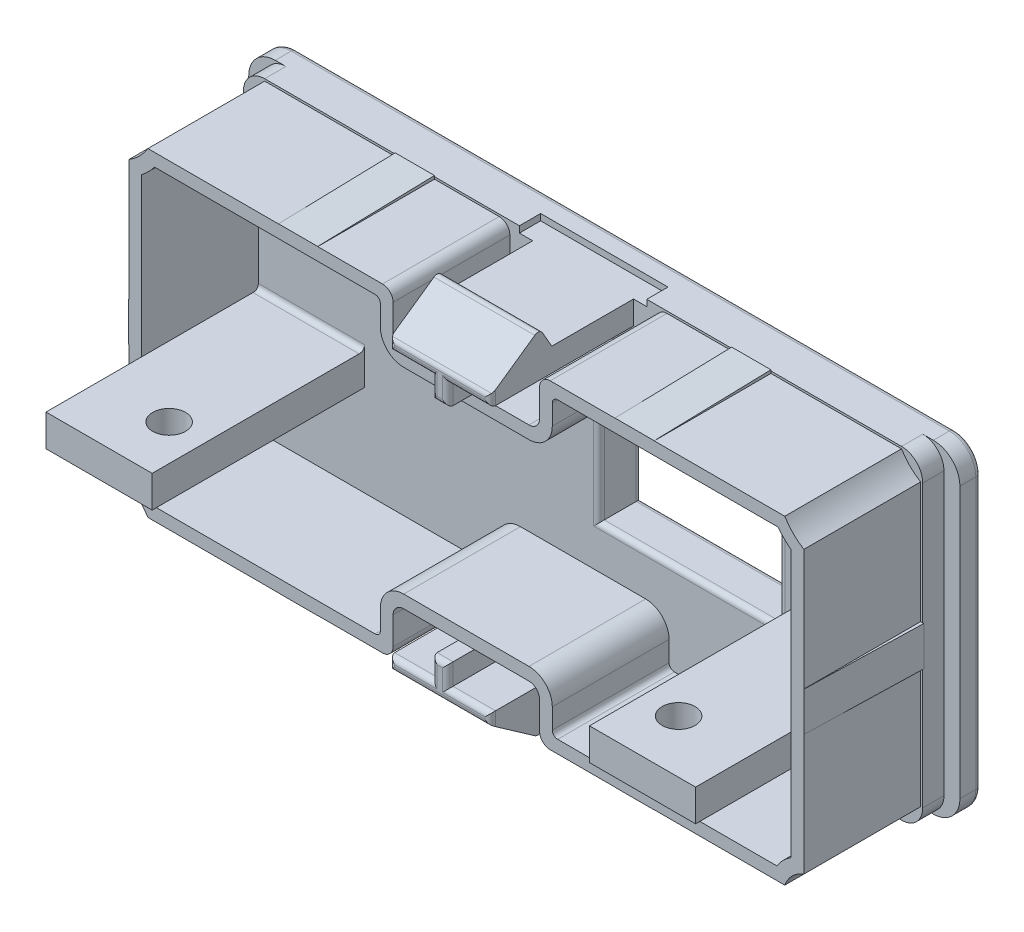
from build123d import *

# Parameters (mm, degrees)
BOSS_EXTRUDE1_DEPTH  = 2
FILLET2_R            = 0.5
BOSS_EXTRUDE2_DEPTH  = 2
SKETCH4_W            = 17
SKETCH4_H            = 14
CUT_EXTRUDE1_DEPTH   = 38.024485273
FILLET3_R            = 0.5
BOSS_EXTRUDE3_DEPTH  = 11
FILLET5_R            = 0.5
SKETCH6_W            = 12
SKETCH6_H            = 0.6
CUT_EXTRUDE2_DEPTH   = 2
BOSS_EXTRUDE4_DEPTH  = 13.5
SKETCH21_W           = 9.5
SKETCH21_H           = 4.65
BOSS_EXTRUDE14_DEPTH = 2
SKETCH22_W           = 9.5
SKETCH22_H           = 4.65
BOSS_EXTRUDE15_DEPTH = 2
DRAFT13_ANGLE        = 30
DRAFT15_ANGLE        = 30
DRAFT16_START        = 21.009338745
DRAFT16_OUTLINE_W    = 9.5
DRAFT16_OUTLINE_H    = 9
DRAFT16_DEPTH        = 3.990661255
DRAFT18_START        = -25
DRAFT18_OUTLINE_W    = 9.5
DRAFT18_OUTLINE_H    = 9
DRAFT18_DEPTH        = 3.990661255
SKETCH12_W           = 3.7
SKETCH12_H           = 11
BOSS_EXTRUDE7_DEPTH  = 0.3
SKETCH14_W           = 3.7
SKETCH14_H           = 11
BOSS_EXTRUDE10_DEPTH = 0.3
SKETCH15_W           = 11
SKETCH15_H           = 3.7
BOSS_EXTRUDE11_DEPTH = 0.3
SKETCH16_W           = 11
SKETCH16_H           = 3.7
BOSS_EXTRUDE12_DEPTH = 0.3
SKETCH17_W           = 10
SKETCH17_H           = 3
BOSS_EXTRUDE13_DEPTH = 20
SKETCH19_R           = 1.55
CUT_EXTRUDE4_DEPTH   = 46.337181283
DRAFT12_ANGLE        = 1.5
FILLET36_SIZE        = 0.5
FILLET37_SIZE        = 0.5
FILLET38_R           = 0.5
FILLET39_R           = 0.5


with BuildPart() as part:
    # Sketch1 → Boss-Extrude1 (new body)
    with BuildSketch(Plane.XY):
        with BuildLine():
            Line((-31, 15.25), (31, 15.25))
            ThreePointArc((31, 15.25), (32.767766953, 14.517766953), (33.5, 12.75))
            Line((33.5, 12.75), (33.5, -12.75))
            ThreePointArc((33.5, -12.75), (32.767766953, -14.517766953), (31, -15.25))
            Line((31, -15.25), (-31, -15.25))
            ThreePointArc((-31, -15.25), (-32.767766953, -14.517766953), (-33.5, -12.75))
            Line((-33.5, -12.75), (-33.5, 12.75))
            ThreePointArc((-33.5, 12.75), (-32.767766953, 14.517766953), (-31, 15.25))
        make_face()
    extrude(amount=BOSS_EXTRUDE1_DEPTH)

    # Fillet2
    fillet2_edges = [part.edges().sort_by_distance(p)[0] for p in [
        (0, -15.25, 0),
        (-32.767766953, -14.517766953, 0),
        (-33.5, 0, 0),
        (-32.767766953, 14.517766953, 0),
        (0, 15.25, 0),
        (32.767766953, 14.517766953, 0),
        (33.5, 0, 0),
        (32.767766953, -14.517766953, 0),
    ]]
    fillet(fillet2_edges, radius=FILLET2_R)

    # Sketch2 → Boss-Extrude2 (add)
    with BuildSketch(Plane.XY.offset(2)):
        with BuildLine():
            Line((-30, 15.25), (30, 15.25))
            ThreePointArc((30, 15.25), (31.414213562, 14.664213562), (32, 13.25))
            Line((32, 13.25), (32, -13.25))
            ThreePointArc((32, -13.25), (31.414213562, -14.664213562), (30, -15.25))
            Line((30, -15.25), (-30, -15.25))
            ThreePointArc((-30, -15.25), (-31.414213562, -14.664213562), (-32, -13.25))
            Line((-32, -13.25), (-32, 13.25))
            ThreePointArc((-32, 13.25), (-31.414213562, 14.664213562), (-30, 15.25))
        make_face()
    extrude(amount=BOSS_EXTRUDE2_DEPTH)

    # Sketch4 → Cut-Extrude1 (cut, through all)
    with BuildSketch(Plane(origin=(0, 0, 0), x_dir=(-1, 0, 0), z_dir=(0, 0, -1))):
        with Locations((-10, 1.75)):
            Rectangle(SKETCH4_W, SKETCH4_H)
    extrude(amount=-CUT_EXTRUDE1_DEPTH, mode=Mode.SUBTRACT)

    # Fillet3
    fillet3_edges = [part.edges().sort_by_distance(p)[0] for p in [
        (1.5, 1.75, 0),
        (10, 8.75, 0),
        (18.5, 1.75, 0),
        (10, -5.25, 0),
    ]]
    fillet(fillet3_edges, radius=FILLET3_R)

    # Sketch5 → Boss-Extrude3 (add)
    with BuildSketch(Plane.XY.offset(4)):
        with BuildLine():
            Line((-6.9, 14.05), (-6.9, 11.45))
            ThreePointArc((-6.9, 11.45), (-6.607106781, 10.742893219), (-5.9, 10.45))
            Line((-5.9, 10.45), (5.9, 10.45))
            ThreePointArc((5.9, 10.45), (6.607106781, 10.742893219), (6.9, 11.45))
            Line((6.9, 11.45), (6.9, 14.05))
            ThreePointArc((6.9, 14.05), (7.192893219, 14.757106781), (7.9, 15.05))
            Line((7.9, 15.05), (30, 15.05))
            ThreePointArc((30, 15.05), (30.792418445, 14.042418445), (31.8, 13.25))
            Line((31.8, 13.25), (31.8, -13.25))
            ThreePointArc((31.8, -13.25), (30.699616928, -13.949616928), (30, -15.05))
            Line((30, -15.05), (7.9, -15.05))
            ThreePointArc((7.9, -15.05), (7.192893219, -14.757106781), (6.9, -14.05))
            Line((6.9, -14.05), (6.9, -11.45))
            ThreePointArc((6.9, -11.45), (6.607106781, -10.742893219), (5.9, -10.45))
            Line((5.9, -10.45), (-5.9, -10.45))
            ThreePointArc((-5.9, -10.45), (-6.607106781, -10.742893219), (-6.9, -11.45))
            Line((-6.9, -11.45), (-6.9, -14.05))
            ThreePointArc((-6.9, -14.05), (-7.192893219, -14.757106781), (-7.9, -15.05))
            Line((-7.9, -15.05), (-30, -15.05))
            ThreePointArc((-30, -15.05), (-30.792418445, -14.042418445), (-31.8, -13.25))
            Line((-31.8, -13.25), (-31.8, 13.25))
            ThreePointArc((-31.8, 13.25), (-30.792418445, 14.042418445), (-30, 15.05))
            Line((-30, 15.05), (-7.9, 15.05))
            ThreePointArc((-7.9, 15.05), (-7.192893219, 14.757106781), (-6.9, 14.05))
        make_face()
        with BuildLine():
            Line((29.256187962, -13.85), (8.1, -13.85))
            Line((8.1, -13.85), (8.1, -11.45))
            ThreePointArc((8.1, -11.45), (7.455634919, -9.894365081), (5.9, -9.25))
            Line((5.9, -9.25), (-5.9, -9.25))
            ThreePointArc((-5.9, -9.25), (-7.455634919, -9.894365081), (-8.1, -11.45))
            Line((-8.1, -11.45), (-8.1, -13.85))
            Line((-8.1, -13.85), (-29.369275917, -13.85))
            ThreePointArc((-29.369275917, -13.85), (-29.943890307, -13.193890307), (-30.6, -12.619275917))
            Line((-30.6, -12.619275917), (-30.6, 12.619275917))
            ThreePointArc((-30.6, 12.619275917), (-29.943890307, 13.193890307), (-29.369275917, 13.85))
            Line((-29.369275917, 13.85), (-8.1, 13.85))
            Line((-8.1, 13.85), (-8.1, 11.45))
            ThreePointArc((-8.1, 11.45), (-7.455634919, 9.894365081), (-5.9, 9.25))
            Line((-5.9, 9.25), (5.9, 9.25))
            ThreePointArc((5.9, 9.25), (7.455634919, 9.894365081), (8.1, 11.45))
            Line((8.1, 11.45), (8.1, 13.85))
            Line((8.1, 13.85), (29.369275917, 13.85))
            ThreePointArc((29.369275917, 13.85), (29.943890307, 13.193890307), (30.6, 12.619275917))
            Line((30.6, 12.619275917), (30.6, -12.506187962))
            ThreePointArc((30.6, -12.506187962), (29.85108879, -13.10108879), (29.256187962, -13.85))
        make_face(mode=Mode.SUBTRACT)
    extrude(amount=BOSS_EXTRUDE3_DEPTH)

    # Fillet5
    fillet5_edges = [part.edges().sort_by_distance(p)[0] for p in [
        (8.1, 13.85, 9.5),
        (-8.1, 13.85, 9.5),
        (-8.1, -13.85, 9.5),
        (8.1, -13.85, 9.5),
    ]]
    fillet(fillet5_edges, radius=FILLET5_R)

    # Sketch6 → Cut-Extrude2 (cut)
    with BuildSketch(Plane.XY.offset(4)):
        with Locations((0, 14.95)):
            Rectangle(SKETCH6_W, SKETCH6_H)
        with Locations((0, -14.95)):
            Rectangle(SKETCH6_W, SKETCH6_H)
    extrude(amount=-CUT_EXTRUDE2_DEPTH, mode=Mode.SUBTRACT)

    # Sketch7 → Boss-Extrude4 (add)
    with BuildSketch(Plane.XY.offset(4)):
        Polygon((-4.75, 14.65), (4.75, 14.65), (4.75, 12.45), (0.75, 12.45), (0.75, 10.45), (-0.75, 10.45), (-0.75, 12.45), (-4.75, 12.45), align=None)
        Polygon((-4.75, -12.45), (-4.75, -14.65), (4.75, -14.65), (4.75, -12.45), (0.75, -12.45), (0.75, -10.45), (-0.75, -10.45), (-0.75, -12.45), align=None)
    extrude(amount=BOSS_EXTRUDE4_DEPTH)

    # Sketch21 → Boss-Extrude14 (add)
    with BuildSketch(Plane(origin=(0, 14.65, 0), x_dir=(1, 0, 0), z_dir=(0, 1, 0))):
        with Locations((0, -15.175)):
            Rectangle(SKETCH21_W, SKETCH21_H)
    extrude(amount=BOSS_EXTRUDE14_DEPTH)

    # Sketch22 → Boss-Extrude15 (add)
    with BuildSketch(Plane.XZ.offset(14.65)):
        with Locations((0, 15.175)):
            Rectangle(SKETCH22_W, SKETCH22_H)
    extrude(amount=BOSS_EXTRUDE15_DEPTH)

    # Draft13
    draft13_faces = [part.faces().sort_by_distance(p)[0] for p in [
        (0, -15.65, 12.85),
    ]]
    draft(draft13_faces, Plane(origin=(0, -16.65, 0), x_dir=(-1, 0, 0), z_dir=(0, -1, 0)), DRAFT13_ANGLE)

    # Draft15
    draft15_faces = [part.faces().sort_by_distance(p)[0] for p in [
        (0, 15.65, 12.85),
    ]]
    draft(draft15_faces, Plane.ZX.offset(16.65), DRAFT15_ANGLE)

    # Draft16: read off the stored shape, not the designer's step
    # Draft16 outline → Draft16 (cut)
    with BuildSketch(Plane(origin=(0, 0, 0), x_dir=(1, 0, 0), z_dir=(0, 0.8191520442889911, 0.5735764363510472)).offset(DRAFT16_START)):
        with Locations((0, -3.5)):
            Rectangle(DRAFT16_OUTLINE_W, DRAFT16_OUTLINE_H)
    extrude(amount=DRAFT16_DEPTH, mode=Mode.SUBTRACT)

    # Draft18: read off the stored shape, not the designer's step
    # Draft18 outline → Draft18 (cut)
    with BuildSketch(Plane(origin=(0, 0, 0), x_dir=(1, 0, 0), z_dir=(0, 0.8191520442889911, -0.5735764363510472)).offset(DRAFT18_START)):
        with Locations((0, -3.5)):
            Rectangle(DRAFT18_OUTLINE_W, DRAFT18_OUTLINE_H)
    extrude(amount=DRAFT18_DEPTH, mode=Mode.SUBTRACT)

    # Sketch12 → Boss-Extrude7 (add)
    with BuildSketch(Plane(origin=(0, 15.05, 0), x_dir=(1, 0, 0), z_dir=(0, 1, 0))):
        with Locations((15.85, -9.5)):
            Rectangle(SKETCH12_W, SKETCH12_H)
        with Locations((-15.85, -9.5)):
            Rectangle(SKETCH12_W, SKETCH12_H)
    extrude(amount=BOSS_EXTRUDE7_DEPTH)

    # Sketch14 → Boss-Extrude10 (add)
    with BuildSketch(Plane.XZ.offset(15.05)):
        with Locations((15.85, 9.5)):
            Rectangle(SKETCH14_W, SKETCH14_H)
        with Locations((-15.85, 9.5)):
            Rectangle(SKETCH14_W, SKETCH14_H)
    extrude(amount=BOSS_EXTRUDE10_DEPTH)

    # Sketch15 → Boss-Extrude11 (add)
    with BuildSketch(Plane.ZY.offset(31.8)):
        with Locations((9.5, 0)):
            Rectangle(SKETCH15_W, SKETCH15_H)
    extrude(amount=BOSS_EXTRUDE11_DEPTH)

    # Sketch16 → Boss-Extrude12 (add)
    with BuildSketch(Plane(origin=(31.8, 0, 0), x_dir=(0, 0, -1), z_dir=(1, 0, 0))):
        with Locations((-9.5, 0)):
            Rectangle(SKETCH16_W, SKETCH16_H)
    extrude(amount=BOSS_EXTRUDE12_DEPTH)

    # Sketch17 → Boss-Extrude13 (add)
    with BuildSketch(Plane.XY.offset(4)):
        with Locations((-25.6, -3.75)):
            Rectangle(SKETCH17_W, SKETCH17_H)
        with Locations((25.6, -3.75)):
            Rectangle(SKETCH17_W, SKETCH17_H)
    extrude(amount=BOSS_EXTRUDE13_DEPTH)

    # Sketch19 → Cut-Extrude4 (cut, through all)
    with BuildSketch(Plane(origin=(0, -2.25, 0), x_dir=(1, 0, 0), z_dir=(0, 1, 0))):
        with Locations(Location((-24, -19, 0), (0, 0, 180))):
            Circle(SKETCH19_R)
        with Locations(Location((24, -19, 0), (0, 0, 180))):
            Circle(SKETCH19_R)
    extrude(amount=-CUT_EXTRUDE4_DEPTH, mode=Mode.SUBTRACT)

    # Draft12
    draft12_faces = [part.faces().sort_by_distance(p)[0] for p in [
        (-15.85, -15.35, 9.5),
        (15.85, -15.35, 9.5),
        (32.1, 0, 9.5),
        (-32.1, 0, 9.5),
        (15.85, 15.35, 9.5),
        (-15.85, 15.35, 9.5),
    ]]
    draft(draft12_faces, Plane(origin=(-30, -13.25, 4), x_dir=(1, 0, 0), z_dir=(0, 0, 1)), DRAFT12_ANGLE)

    # Fillet36
    # a fillet whose section is not a circle: 0.5 mm, written as the material it takes off along each edge
    with BuildSketch(Plane(origin=(1.5, -5.25, 4), x_dir=(0, -1, 0), z_dir=(1, 0, 0)), Plane(origin=(18.5, 8.75, 4), x_dir=(0, 1, 0), z_dir=(-1, 0, 0))) as fillet36_piece_1:
        with BuildLine():
            Bezier((FILLET36_SIZE, 0), (0, 0), (0, FILLET36_SIZE), weights=[1, 1, 1])
            Line((0, FILLET36_SIZE), (0, 0))
            Line((0, 0), (FILLET36_SIZE, 0))
        make_face()
    extrude(amount=17, mode=Mode.SUBTRACT)
    with BuildSketch(Plane(origin=(18.5, -5.25, 4), x_dir=(1, 0, 0), z_dir=(0, 1, 0)), Plane(origin=(1.5, 8.75, 4), x_dir=(-1, 0, 0), z_dir=(0, -1, 0))) as fillet36_piece_2:
        with BuildLine():
            Bezier((FILLET36_SIZE, 0), (0, 0), (0, FILLET36_SIZE), weights=[1, 1, 1])
            Line((0, FILLET36_SIZE), (0, 0))
            Line((0, 0), (FILLET36_SIZE, 0))
        make_face()
    extrude(amount=14, mode=Mode.SUBTRACT)
    with BuildSketch(Plane(origin=(0.25, -5.25, 4), x_dir=(0, -1, 0), z_dir=(1, 0, 0))) as fillet36_piece_3a_section:
        with BuildLine():
            Bezier((FILLET36_SIZE, 0), (0, 0), (0, FILLET36_SIZE), weights=[1, 1, 1])
            Line((0, FILLET36_SIZE), (0, 0))
            Line((0, 0), (FILLET36_SIZE, 0))
        make_face()
    fillet36_piece_3a = extrude(amount=18.25, mode=Mode.PRIVATE)
    fillet36_piece_3a = split(fillet36_piece_3a, bisect_by=Plane(origin=(1.5, -5.25, 4), z_dir=(-1, 0, 0)), keep=Keep.TOP, mode=Mode.PRIVATE)
    with BuildSketch(Plane(origin=(1.5, 8.75, 4), x_dir=(-1, 0, 0), z_dir=(0, -1, 0))) as fillet36_piece_3b_section:
        with BuildLine():
            Bezier((FILLET36_SIZE, 0), (0, 0), (0, FILLET36_SIZE), weights=[1, 1, 1])
            Line((0, FILLET36_SIZE), (0, 0))
            Line((0, 0), (FILLET36_SIZE, 0))
        make_face()
    fillet36_piece_3b = extrude(amount=15.25, mode=Mode.PRIVATE)
    fillet36_piece_3b = split(fillet36_piece_3b, bisect_by=Plane(origin=(1.5, -5.25, 4), z_dir=(0, -1, 0)), keep=Keep.TOP, mode=Mode.PRIVATE)
    fillet36_piece_3 = fillet36_piece_3a & fillet36_piece_3b
    add(fillet36_piece_3, mode=Mode.SUBTRACT)
    with BuildSketch(Plane(origin=(18.5, -6.5, 4), x_dir=(1, 0, 0), z_dir=(0, 1, 0))) as fillet36_piece_4a_section:
        with BuildLine():
            Bezier((FILLET36_SIZE, 0), (0, 0), (0, FILLET36_SIZE), weights=[1, 1, 1])
            Line((0, FILLET36_SIZE), (0, 0))
            Line((0, 0), (FILLET36_SIZE, 0))
        make_face()
    fillet36_piece_4a = extrude(amount=15.25, mode=Mode.PRIVATE)
    fillet36_piece_4a = split(fillet36_piece_4a, bisect_by=Plane(origin=(18.5, -5.25, 4), z_dir=(0, -1, 0)), keep=Keep.TOP, mode=Mode.PRIVATE)
    with BuildSketch(Plane(origin=(1.5, -5.25, 4), x_dir=(0, -1, 0), z_dir=(1, 0, 0))) as fillet36_piece_4b_section:
        with BuildLine():
            Bezier((FILLET36_SIZE, 0), (0, 0), (0, FILLET36_SIZE), weights=[1, 1, 1])
            Line((0, FILLET36_SIZE), (0, 0))
            Line((0, 0), (FILLET36_SIZE, 0))
        make_face()
    fillet36_piece_4b = extrude(amount=18.25, mode=Mode.PRIVATE)
    fillet36_piece_4b = split(fillet36_piece_4b, bisect_by=Plane(origin=(18.5, -5.25, 4), z_dir=(1, 0, 0)), keep=Keep.TOP, mode=Mode.PRIVATE)
    fillet36_piece_4 = fillet36_piece_4a & fillet36_piece_4b
    add(fillet36_piece_4, mode=Mode.SUBTRACT)
    with BuildSketch(Plane(origin=(18.5, -5.25, 4), x_dir=(1, 0, 0), z_dir=(0, 1, 0))) as fillet36_piece_5a_section:
        with BuildLine():
            Bezier((FILLET36_SIZE, 0), (0, 0), (0, FILLET36_SIZE), weights=[1, 1, 1])
            Line((0, FILLET36_SIZE), (0, 0))
            Line((0, 0), (FILLET36_SIZE, 0))
        make_face()
    fillet36_piece_5a = extrude(amount=15.25, mode=Mode.PRIVATE)
    fillet36_piece_5a = split(fillet36_piece_5a, bisect_by=Plane(origin=(18.5, 8.75, 4), z_dir=(0, 1, 0)), keep=Keep.TOP, mode=Mode.PRIVATE)
    with BuildSketch(Plane(origin=(19.75, 8.75, 4), x_dir=(0, 1, 0), z_dir=(-1, 0, 0))) as fillet36_piece_5b_section:
        with BuildLine():
            Bezier((FILLET36_SIZE, 0), (0, 0), (0, FILLET36_SIZE), weights=[1, 1, 1])
            Line((0, FILLET36_SIZE), (0, 0))
            Line((0, 0), (FILLET36_SIZE, 0))
        make_face()
    fillet36_piece_5b = extrude(amount=18.25, mode=Mode.PRIVATE)
    fillet36_piece_5b = split(fillet36_piece_5b, bisect_by=Plane(origin=(18.5, 8.75, 4), z_dir=(1, 0, 0)), keep=Keep.TOP, mode=Mode.PRIVATE)
    fillet36_piece_5 = fillet36_piece_5a & fillet36_piece_5b
    add(fillet36_piece_5, mode=Mode.SUBTRACT)
    with BuildSketch(Plane(origin=(18.5, 8.75, 4), x_dir=(0, 1, 0), z_dir=(-1, 0, 0))) as fillet36_piece_6a_section:
        with BuildLine():
            Bezier((FILLET36_SIZE, 0), (0, 0), (0, FILLET36_SIZE), weights=[1, 1, 1])
            Line((0, FILLET36_SIZE), (0, 0))
            Line((0, 0), (FILLET36_SIZE, 0))
        make_face()
    fillet36_piece_6a = extrude(amount=18.25, mode=Mode.PRIVATE)
    fillet36_piece_6a = split(fillet36_piece_6a, bisect_by=Plane(origin=(1.5, 8.75, 4), z_dir=(-1, 0, 0)), keep=Keep.TOP, mode=Mode.PRIVATE)
    with BuildSketch(Plane(origin=(1.5, 10, 4), x_dir=(-1, 0, 0), z_dir=(0, -1, 0))) as fillet36_piece_6b_section:
        with BuildLine():
            Bezier((FILLET36_SIZE, 0), (0, 0), (0, FILLET36_SIZE), weights=[1, 1, 1])
            Line((0, FILLET36_SIZE), (0, 0))
            Line((0, 0), (FILLET36_SIZE, 0))
        make_face()
    fillet36_piece_6b = extrude(amount=15.25, mode=Mode.PRIVATE)
    fillet36_piece_6b = split(fillet36_piece_6b, bisect_by=Plane(origin=(1.5, 9.25, 4), z_dir=(0, -1, 0)), keep=Keep.TOP, mode=Mode.PRIVATE)
    fillet36_piece_6b = split(fillet36_piece_6b, bisect_by=Plane(origin=(1.5, 8.75, 4), z_dir=(0, 1, 0)), keep=Keep.TOP, mode=Mode.PRIVATE)
    fillet36_piece_6 = fillet36_piece_6a & fillet36_piece_6b
    add(fillet36_piece_6, mode=Mode.SUBTRACT)

    # Fillet37
    # a fillet whose section is not a circle: 0.5 mm, written as the material it adds along each edge
    with BuildSketch(Plane(origin=(20.6, -2.25, 4), x_dir=(0, 1, 0), z_dir=(1, 0, 0))) as fillet37_piece_1_section:
        with BuildLine():
            Bezier((FILLET37_SIZE, 0), (0, 0), (0, FILLET37_SIZE), weights=[1, 1, 1])
            Line((0, FILLET37_SIZE), (0, 0))
            Line((0, 0), (FILLET37_SIZE, 0))
        make_face()
    fillet37_piece_1 = extrude(amount=11.25, mode=Mode.PRIVATE)
    fillet37_piece_1 = split(fillet37_piece_1, bisect_by=Plane(origin=(31.8, -2.25, 4), z_dir=(-1, 0, 0)), keep=Keep.TOP, mode=Mode.PRIVATE)
    add(fillet37_piece_1)
    with BuildSketch(Plane(origin=(-31.85, -2.25, 4), x_dir=(0, 1, 0), z_dir=(1, 0, 0))) as fillet37_piece_2_section:
        with BuildLine():
            Bezier((FILLET37_SIZE, 0), (0, 0), (0, FILLET37_SIZE), weights=[1, 1, 1])
            Line((0, FILLET37_SIZE), (0, 0))
            Line((0, 0), (FILLET37_SIZE, 0))
        make_face()
    fillet37_piece_2 = extrude(amount=11.25, mode=Mode.PRIVATE)
    fillet37_piece_2 = split(fillet37_piece_2, bisect_by=Plane(origin=(-31.8, -2.25, 4), z_dir=(1, 0, 0)), keep=Keep.TOP, mode=Mode.PRIVATE)
    add(fillet37_piece_2)

    # Fillet38
    fillet38_edges = [part.edges().sort_by_distance(p)[0] for p in [
        (0, 16.65, 12.85),
        (0, -16.65, 12.85),
    ]]
    fillet(fillet38_edges, radius=FILLET38_R)

    # Fillet39
    fillet39_edges = [part.edges().sort_by_distance(p)[0] for p in [
        (2.75, 12.45, 17.5),
        (4.75, 12.922017474, 17.5),
        (-4.75, 12.922017474, 17.5),
        (-2.75, 12.45, 17.5),
        (-0.75, 11.45, 17.5),
        (0, 10.45, 17.5),
        (0.75, 11.45, 17.5),
        (4.75, -12.922017474, 17.5),
        (2.75, -12.45, 17.5),
        (0.75, -11.45, 17.5),
        (0, -10.45, 17.5),
        (-0.75, -11.45, 17.5),
        (-2.75, -12.45, 17.5),
        (-4.75, -12.922017474, 17.5),
        (0, 13.394034948, 17.5),
        (0, -13.394034948, 17.5),
    ]]
    fillet(fillet39_edges, radius=FILLET39_R)


solid = part.part
